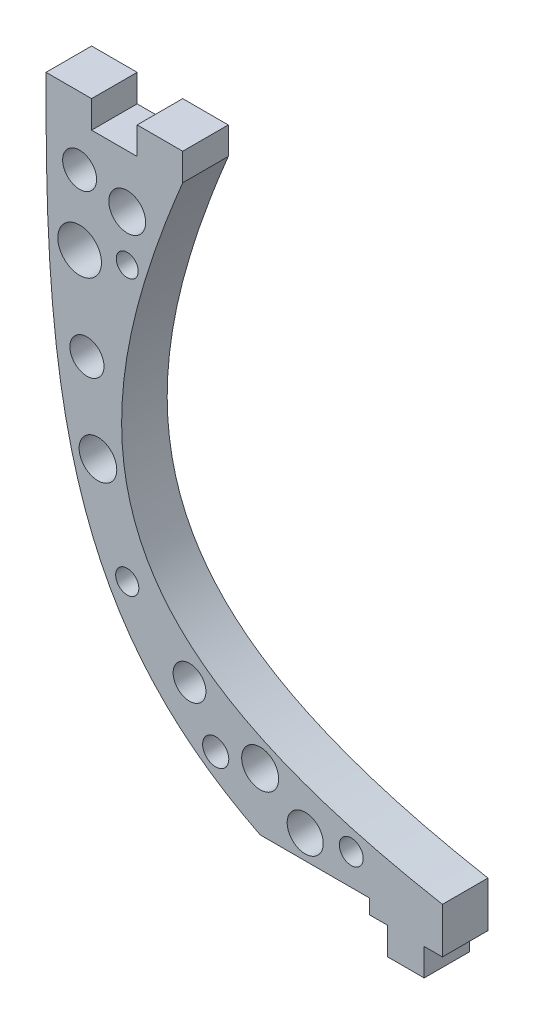
from build123d import *

# Parameters (mm, degrees)
ESQUISSE3_R        = 1.799094092
ESQUISSE3_R_2      = 1.436016343
ESQUISSE3_R_3      = 1.271503072
ESQUISSE3_R_4      = 2.067863533
ESQUISSE3_R_5      = 1.980661688
ESQUISSE3_R_6      = 2.031777992
ESQUISSE3_R_7      = 1.31161039
ESQUISSE3_R_8      = 1.870132193
ESQUISSE3_R_9      = 2.393973193
ESQUISSE3_R_10     = 1.206253728
ESQUISSE3_R_11     = 2.023509578
ESQUISSE3_R_12     = 1.863947
BOSS_EXTRU_1_DEPTH = 5


with BuildPart() as part:
    # Esquisse3 → Boss.-Extru.1 (new body)
    with BuildSketch(Plane.XY):
        with BuildLine():
            Line((30, -1.6), (30, -4.6))
            Line((30, -4.6), (34, -4.6))
            Line((34, -4.6), (34, -1.6))
            Line((34, -1.6), (36, -1.6))
            Line((36, -1.6), (36, 3.4))
            add(Edge.make_bspline(
                [(36, 3.4), (-1.275512635, 10.212780912), (-5.567144123, 26.426699492), (7.5, 57.73)],
                knots=[0, 0, 0, 0, 1, 1, 1, 1], degree=3))
            Line((7.5, 57.73), (7.5, 60.73))
            Line((7.5, 60.73), (2.5, 60.73))
            Line((2.5, 60.73), (2.5, 57.73))
            Line((2.5, 57.73), (0, 57.73))
            Line((0, 57.73), (-2.5, 57.73))
            Line((-2.5, 57.73), (-2.5, 60.73))
            Line((-2.5, 60.73), (-7.5, 60.73))
            Line((-7.5, 60.73), (-7.5, 57.73))
            add(Edge.make_bspline(
                [(16, 0), (-3.920324015, 9.982505189), (-7.5, 27.800800799), (-7.5, 57.73)],
                knots=[0, 0, 0, 0, 1, 1, 1, 1], degree=3))
            Line((16, 0), (28, 0))
            Line((28, 0), (28, -1.6))
            Line((28, -1.6), (30, -1.6))
        make_face()
        with Locations((8.247451688, 10.630885312)):
            Circle(ESQUISSE3_R, mode=Mode.SUBTRACT)
        with Locations((11.119484373, 5.461226479)):
            Circle(ESQUISSE3_R_2, mode=Mode.SUBTRACT)
        with Locations((1.412013898, 16.777035258)):
            Circle(ESQUISSE3_R_3, mode=Mode.SUBTRACT)
        with Locations((-1.804662709, 26.829149655)):
            Circle(ESQUISSE3_R_4, mode=Mode.SUBTRACT)
        with Locations((20.941836156, 2.646634447)):
            Circle(ESQUISSE3_R_5, mode=Mode.SUBTRACT)
        with Locations((16, 6.322836284)):
            Circle(ESQUISSE3_R_6, mode=Mode.SUBTRACT)
        with Locations((25.996613682, 3.4)):
            Circle(ESQUISSE3_R_7, mode=Mode.SUBTRACT)
        with Locations((-3.010916437, 35.962213594)):
            Circle(ESQUISSE3_R_8, mode=Mode.SUBTRACT)
        with Locations((-3.815085589, 45.669684069)):
            Circle(ESQUISSE3_R_9, mode=Mode.SUBTRACT)
        with Locations((1.412013898, 46.875937797)):
            Circle(ESQUISSE3_R_10, mode=Mode.SUBTRACT)
        with Locations((1.412013898, 51.930715323)):
            Circle(ESQUISSE3_R_11, mode=Mode.SUBTRACT)
        with Locations((-3.815085589, 53.309291012)):
            Circle(ESQUISSE3_R_12, mode=Mode.SUBTRACT)
    extrude(amount=BOSS_EXTRU_1_DEPTH)


solid = part.part
